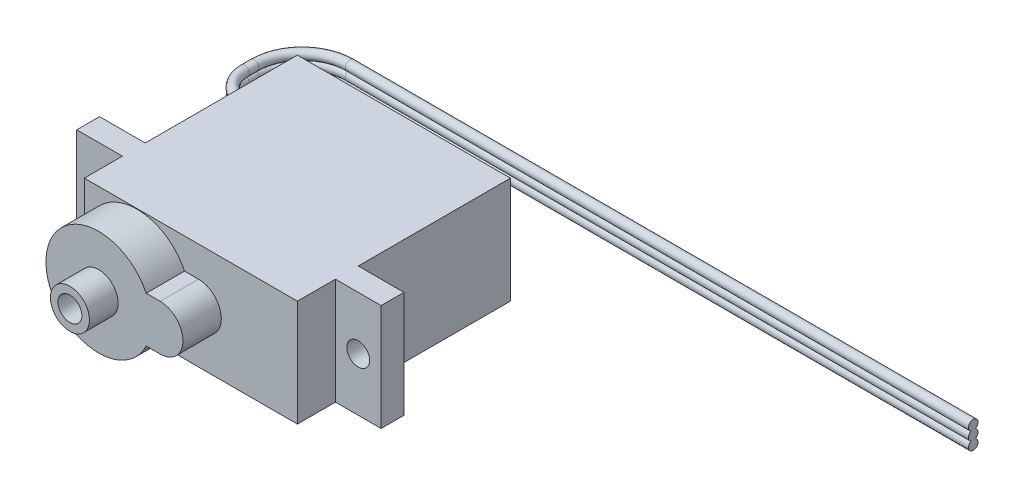
from build123d import *

# Parameters (mm, degrees)
P_IDAT_VYSUNUT_M1_DEPTH  = 5.555
P_IDAT_VYSUNUT_M2_DEPTH  = 4
SKICA3_R                 = 2.03883748
SKICA3_R_2               = 1.24519559
P_IDAT_VYSUNUT_M3_DEPTH  = 3
SKICA5_R                 = 1.190602913
SKICA5_R_2               = 1.19060243
ODEBRAT_VYSUNUT_M1_DEPTH = 23
SKICA7_W                 = 1
SKICA7_H                 = 4
P_IDAT_VYSUNUT_M4_DEPTH  = 1


# Read off the part's stored shape, not the designer's step: Přidat vysunutím2
with BuildPart() as part:
    # Skica1 → Přidat vysunutím1 (new, symmetric)
    with BuildSketch(Plane(origin=(0, 0, 0), x_dir=(1, 0, 0), z_dir=(0, 1, 0))):
        Polygon((11.32935, -15.875), (16.09185, -15.875), (16.09185, -18.25625), (11.32935, -18.25625), (11.32935, -22.225), (-10.89565, -22.225), (-10.89565, -18.25625), (-15.65815, -18.25625), (-15.65815, -15.875), (-10.89565, -15.875), (-10.89565, 0), (11.32935, 0), align=None)
    extrude(amount=P_IDAT_VYSUNUT_M1_DEPTH, both=True)

    # Přidat vysunutím2 outline → Přidat vysunutím2 (add)
    with BuildSketch(Plane.XY.offset(22.225)):
        with BuildLine():
            Line((-10.89565, 0.263816958), (-10.89565, -0.263816958))
            ThreePointArc((-10.89565, -0.263816958), (-6.494080203, -5.390484118), (-0.444197365, -2.381256561))
            Line((-0.444197365, -2.381256561), (1.010536018, -2.381256561))
            ThreePointArc((1.010536018, -2.381256561), (3.391829299, 2.729e-06), (1.010604, 2.38133))
            Line((1.010604, 2.38133), (-0.444232639, 2.38133))
            ThreePointArc((-0.444232639, 2.38133), (-6.494120128, 5.390476029), (-10.89565, 0.263816958))
        make_face()
    extrude(amount=P_IDAT_VYSUNUT_M2_DEPTH)

    # Skica3 → Přidat vysunutím3 (add)
    with BuildSketch(Plane.XY.offset(26.225)):
        with Locations((-5.401980861, 0)):
            Circle(SKICA3_R)
        with Locations((-5.401980861, 0)):
            Circle(SKICA3_R_2, mode=Mode.SUBTRACT)
    extrude(amount=P_IDAT_VYSUNUT_M3_DEPTH)

    # Skica5 → Odebrat vysunutím1 (cut)
    with BuildSketch(Plane.XY.offset(18.25625)):
        with Locations((-13.276937552, 5.8558e-05)):
            Circle(SKICA5_R)
        with Locations((13.71053658, 6.1415e-05)):
            Circle(SKICA5_R_2)
    extrude(amount=-ODEBRAT_VYSUNUT_M1_DEPTH, mode=Mode.SUBTRACT)

    # Skica7 → Přidat vysunutím4 (add)
    with BuildSketch(Plane(origin=(-10.89565, 0, 10.89565), x_dir=(0, 0, -1), z_dir=(1, 0, 0))):
        with Locations((7.39565, 0)):
            Rectangle(SKICA7_W, SKICA7_H)
    extrude(amount=-P_IDAT_VYSUNUT_M4_DEPTH)


with BuildPart() as body_2:
    # Táhnout po křivce3: sweep along a path in Skica9
    with BuildLine(Plane(origin=(0, 0, 0), x_dir=(1, 0, 0), z_dir=(0, 1, 0))) as t_hnout_po_k_ivce3_path:
        Line((-10.89565, -2.5), (-13.89565, -2.5))
        ThreePointArc((-13.89565, -2.5), (-16.016970344, -1.621320344), (-16.89565, 0.5))
        Line((-16.89565, 0.5), (-16.89565, 1.5))
        ThreePointArc((-16.89565, 1.5), (-15.431183906, 5.035533906), (-11.89565, 6.5))
        Line((-11.89565, 6.5), (53.10435, 6.5))
    # Skica8 → Táhnout po křivce3 (sweep)
    with BuildSketch(Plane(origin=(-10.89565, 0, 10.89565), x_dir=(0, 0, -1), z_dir=(1, 0, 0))):
        with BuildLine():
            ThreePointArc((8.177705053, 0.45), (7.89565, 0), (8.177705053, -0.45))
            ThreePointArc((8.177705053, -0.45), (8.39565, -1.4), (8.613594947, -0.45))
            ThreePointArc((8.613594947, -0.45), (8.89565, 0), (8.613594947, 0.45))
            ThreePointArc((8.613594947, 0.45), (8.39565, 1.4), (8.177705053, 0.45))
        make_face()
    sweep(path=t_hnout_po_k_ivce3_path.line)


solid = Compound([part.part, body_2.part])
